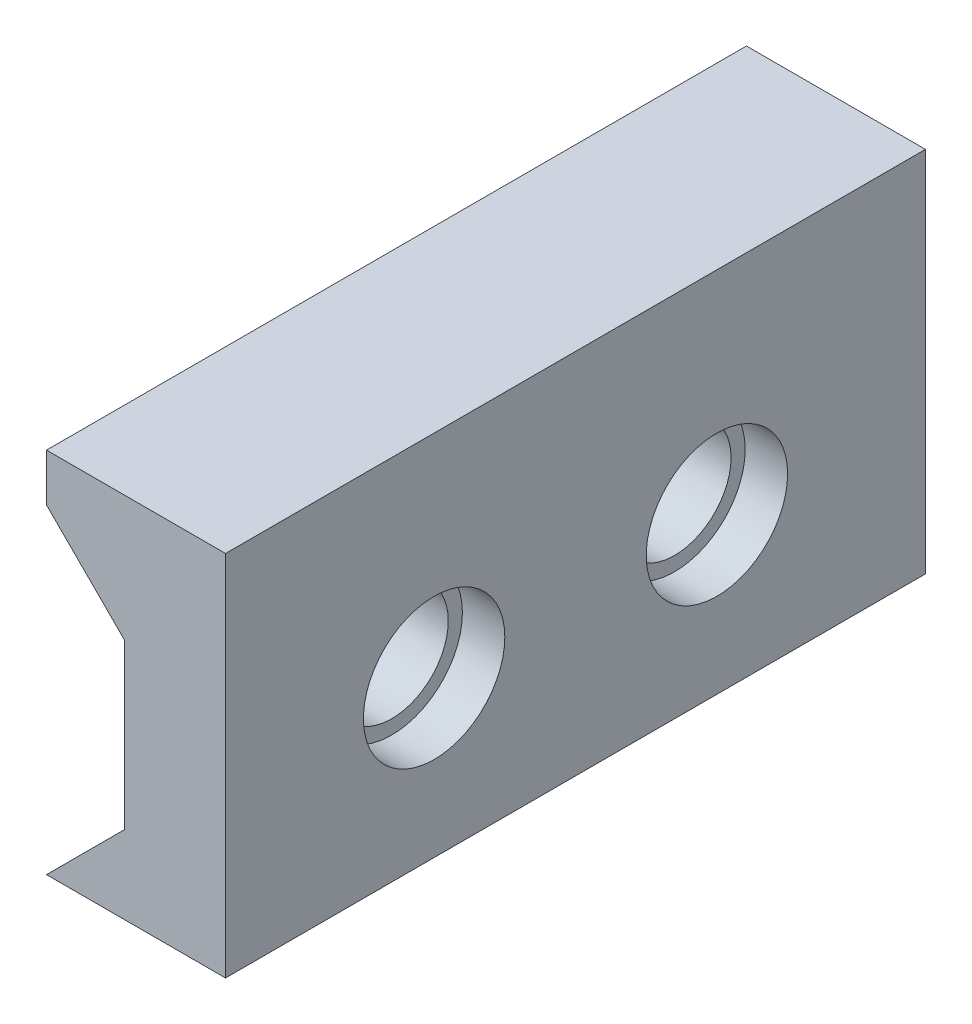
from build123d import *

# Parameters (mm, degrees)
DODANIE_WYCI_GNI_CIE1_DEPTH = 24.75
SZKIC2_R                    = 2
WYTNIJ_WYCI_GNI_CIE1_DEPTH  = 14
SZKIC3_R                    = 2.5
WYTNIJ_WYCI_GNI_CIE2_DEPTH  = 1.5


with BuildPart() as part:
    # Szkic1 → Dodanie-wyciągnięcie1 (new body)
    with BuildSketch(Plane.XY):
        Polygon((14, -7.5), (7.67, -7.5), (10.434999646, -4.735000354), (10.434999646, 1.054999646), (7.67, 3.819999293), (7.67, 5.5), (14, 5.5), align=None)
    extrude(amount=DODANIE_WYCI_GNI_CIE1_DEPTH)

    # Szkic2 → Wytnij-wyciągnięcie1 (cut)
    with BuildSketch(Plane(origin=(14, 0, 0), x_dir=(0, 0, -1), z_dir=(1, 0, 0))):
        with Locations((-17.375, -2)):
            Circle(SZKIC2_R)
        with Locations((-7.375, -2)):
            Circle(SZKIC2_R)
    extrude(amount=-WYTNIJ_WYCI_GNI_CIE1_DEPTH, mode=Mode.SUBTRACT)

    # Szkic3 → Wytnij-wyciągnięcie2 (cut)
    with BuildSketch(Plane(origin=(14, 0, 0), x_dir=(0, 0, -1), z_dir=(1, 0, 0))):
        with Locations((-17.375, -2)):
            Circle(SZKIC3_R)
        with Locations((-7.375, -2)):
            Circle(SZKIC3_R)
    extrude(amount=-WYTNIJ_WYCI_GNI_CIE2_DEPTH, mode=Mode.SUBTRACT)


solid = part.part
